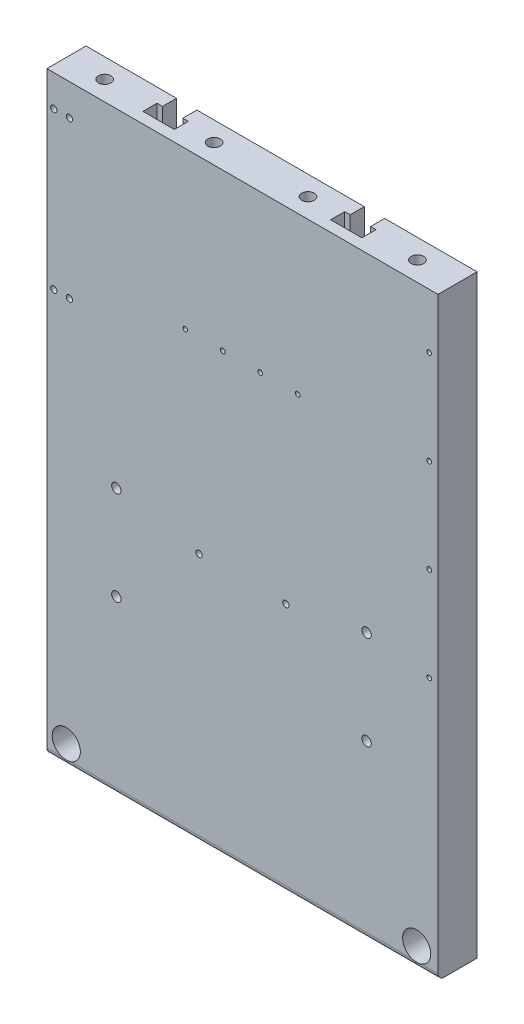
from build123d import *

# Parameters (mm, degrees)
SKETCH_1_W          = 250
SKETCH_1_H          = 380
SKETCH_1_R          = 9
SKETCH_1_R_2        = 2
SKETCH_1_R_3        = 1.5
SKETCH_1_R_4        = 3
EXTRUDE_3_DEPTH     = 25
CUT_EXTRUDE_1_DEPTH = 416
SKETCH_3_4_R        = 4
CUT_EXTRUDE_2_DEPTH = 55
SKETCH_5_W          = 76.418543054
SKETCH_5_H          = 18.162254628
EXTRUDE_4_DEPTH     = 12
SKETCH_6_W          = 9.937837438
SKETCH_6_H          = 197.728696601
EXTRUDE_5_DEPTH     = 12
SKETCH_7_W          = 21.060874429
SKETCH_7_H          = 111.734651623
EXTRUDE_6_DEPTH     = 12
SKETCH_8_W          = 15.76346628
SKETCH_8_H          = 76.418543054
EXTRUDE_7_DEPTH     = 5
SKETCH_9_W          = 10.965889587
SKETCH_9_H          = 75.390490905
EXTRUDE_8_DEPTH     = 5
SKETCH_10_W         = 21.30480461
SKETCH_10_H         = 26.996927979
SKETCH_10_R         = 6
EXTRUDE_11_DEPTH    = 11
FILLET_1_R          = 4
SKETCH_11_R         = 2
CUT_EXTRUDE_3_DEPTH = 13


with BuildPart() as part:
    # 草图1 → 凸台-拉伸3 (new body)
    with BuildSketch(Plane.XY):
        with Locations((125.613842041, 190.076299127)):
            Rectangle(SKETCH_1_W, SKETCH_1_H)
        with Locations((13, 12.5)):
            Circle(SKETCH_1_R, mode=Mode.SUBTRACT)
        with Locations((237, 12.5)):
            Circle(SKETCH_1_R, mode=Mode.SUBTRACT)
        with Locations((5, 360)):
            Circle(SKETCH_1_R_2, mode=Mode.SUBTRACT)
        with Locations((5, 260)):
            Circle(SKETCH_1_R_2, mode=Mode.SUBTRACT)
        with Locations((15, 360)):
            Circle(SKETCH_1_R_2, mode=Mode.SUBTRACT)
        with Locations((15, 260)):
            Circle(SKETCH_1_R_2, mode=Mode.SUBTRACT)
        with Locations((89, 280)):
            Circle(SKETCH_1_R_3, mode=Mode.SUBTRACT)
        with Locations((113, 280)):
            Circle(SKETCH_1_R_3, mode=Mode.SUBTRACT)
        with Locations((137, 280)):
            Circle(SKETCH_1_R_3, mode=Mode.SUBTRACT)
        with Locations((161, 280)):
            Circle(SKETCH_1_R_3, mode=Mode.SUBTRACT)
        with Locations((45, 110)):
            Circle(SKETCH_1_R_4, mode=Mode.SUBTRACT)
        with Locations((45, 170)):
            Circle(SKETCH_1_R_4, mode=Mode.SUBTRACT)
        with Locations((205, 170)):
            Circle(SKETCH_1_R_4, mode=Mode.SUBTRACT)
        with Locations((205, 110)):
            Circle(SKETCH_1_R_4, mode=Mode.SUBTRACT)
        with Locations((245, 345)):
            Circle(SKETCH_1_R_3, mode=Mode.SUBTRACT)
        with Locations((245, 285)):
            Circle(SKETCH_1_R_3, mode=Mode.SUBTRACT)
        with Locations((245, 225)):
            Circle(SKETCH_1_R_3, mode=Mode.SUBTRACT)
        with Locations((245, 165)):
            Circle(SKETCH_1_R_3, mode=Mode.SUBTRACT)
    extrude(amount=EXTRUDE_3_DEPTH)

    # 草图3 → 切除-拉伸1 (cut)
    with BuildSketch(Plane(origin=(0, 380.076299127, 0), x_dir=(1, 0, 0), z_dir=(0, 1, 0))):
        Polygon((71.5, -9), (71.5, 0), (58.5, 0), (58.5, -9), (55, -9), (55, -18), (75, -18), (75, -9), align=None)
        Polygon((191.5, 0), (178.5, 0), (178.5, -9), (175, -9), (175, -18), (195, -18), (195, -9), (191.5, -9), align=None)
    extrude(amount=-CUT_EXTRUDE_1_DEPTH, mode=Mode.SUBTRACT)

    # 草图3<4> → 切除-拉伸2 (cut)
    with BuildSketch(Plane(origin=(0, 380.076299127, 0), x_dir=(1, 0, 0), z_dir=(0, 1, 0))):
        with Locations(Location((95, -12.5, 0), (0, 0, 270))):
            Circle(SKETCH_3_4_R)
        with Locations(Location((155, -12.5, 0), (0, 0, 270))):
            Circle(SKETCH_3_4_R)
        with Locations(Location((225, -12.5, 0), (0, 0, 270))):
            Circle(SKETCH_3_4_R)
        with Locations(Location((25, -12.5, 0), (0, 0, 270))):
            Circle(SKETCH_3_4_R)
    extrude(amount=-CUT_EXTRUDE_2_DEPTH, mode=Mode.SUBTRACT)

    # 草图5 → 凸台-拉伸4 (add)
    with BuildSketch(Plane(origin=(0, 0, 0), x_dir=(-1, 0, 0), z_dir=(0, 0, -1))):
        with Locations((-124.414447867, 279.859520114)):
            Rectangle(SKETCH_5_W, SKETCH_5_H)
    extrude(amount=-EXTRUDE_4_DEPTH)

    # 草图6 → 凸台-拉伸5 (add)
    with BuildSketch(Plane(origin=(0, 0, 0), x_dir=(-1, 0, 0), z_dir=(0, 0, -1))):
        with Locations((-244.34867248, 253.130164248)):
            Rectangle(SKETCH_6_W, SKETCH_6_H)
    extrude(amount=-EXTRUDE_5_DEPTH)

    # 草图7 → 凸台-拉伸6 (add)
    with BuildSketch(Plane(origin=(0, 0, 0), x_dir=(-1, 0, 0), z_dir=(0, 0, -1))):
        with Locations((-11.144279256, 310.45109449)):
            Rectangle(SKETCH_7_W, SKETCH_7_H)
    extrude(amount=-EXTRUDE_6_DEPTH)

    # 草图8 → 凸台-拉伸7 (add)
    with BuildSketch(Plane(origin=(0, 0, 0), x_dir=(-1, 0, 0), z_dir=(0, 0, -1))):
        with Locations((-204.431173441, 138.673691692)):
            Rectangle(SKETCH_8_W, SKETCH_8_H)
    extrude(amount=-EXTRUDE_7_DEPTH)

    # 草图9 → 凸台-拉伸8 (add)
    with BuildSketch(Plane(origin=(0, 0, 0), x_dir=(-1, 0, 0), z_dir=(0, 0, -1))):
        with Locations((-45.425774442, 139.530401815)):
            Rectangle(SKETCH_9_W, SKETCH_9_H)
    extrude(amount=-EXTRUDE_8_DEPTH)

    # 草图10 → 凸台-拉伸11 (add)
    # profile 1 of 2: a face of its own
    with BuildSketch(Plane(origin=(0, 0, 0), x_dir=(-1, 0, 0), z_dir=(0, 0, -1))):
        with Locations((-236.946967286, 15.123600302)):
            Rectangle(SKETCH_10_W, SKETCH_10_H)
        with Locations((-237, 12.5)):
            Circle(SKETCH_10_R, mode=Mode.SUBTRACT)
    # profile 2 of 2: a face of its own
    with BuildSketch(Plane(origin=(0, 0, 0), x_dir=(-1, 0, 0), z_dir=(0, 0, -1))):
        with Locations((-13.053032714, 15.123600302)):
            Rectangle(SKETCH_10_W, SKETCH_10_H)
        with Locations((-13, 12.5)):
            Circle(SKETCH_10_R, mode=Mode.SUBTRACT)
    extrude(amount=-EXTRUDE_11_DEPTH)

    # 圆角1
    # the kernel refuses this fillet: 4 mm, written as the material it takes off along each edge
    with BuildSketch(Plane(origin=(-9.386157959, 0.076299127, 25), x_dir=(0, 0, -1), z_dir=(1, 0, 0))) as fillet_1_piece_1:
        with BuildLine():
            CenterArc((FILLET_1_R, FILLET_1_R), FILLET_1_R, 180, 90)
            Line((0, FILLET_1_R), (0, 0))
            Line((0, 0), (FILLET_1_R, 0))
        make_face()
    extrude(amount=270, mode=Mode.SUBTRACT)

    # 草图11 → 切除-拉伸3 (cut)
    with BuildSketch(Plane.XY.offset(25)):
        with Locations((153.363842041, 160.076299127)):
            Circle(SKETCH_11_R)
        with Locations((97.863842041, 160.076299127)):
            Circle(SKETCH_11_R)
    extrude(amount=-CUT_EXTRUDE_3_DEPTH, mode=Mode.SUBTRACT)


solid = part.part
